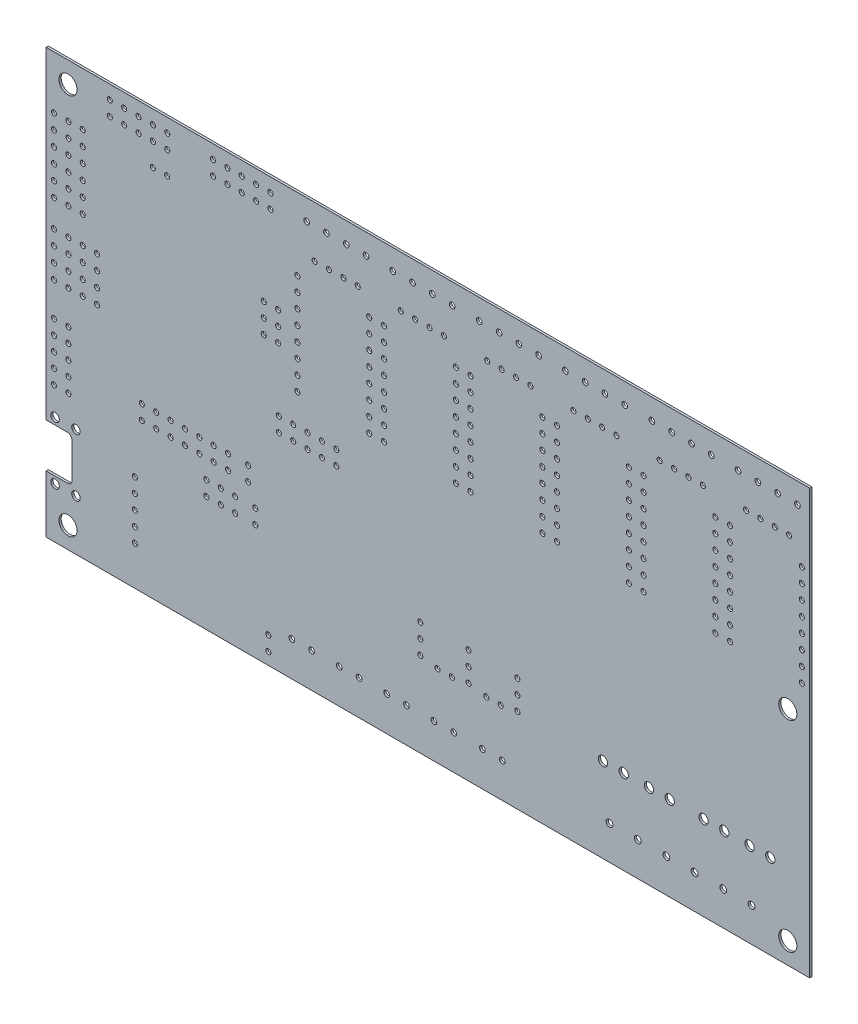
from build123d import *

# Parameters (mm, degrees)
SKETCH1_W             = 135
SKETCH1_H             = 75
BOARD_DEPTH           = 0.39116
SKETCH2_R             = 1.6
CUT_EXTRUDE1_DEPTH    = 0.39116
SKETCH3_R             = 1.6
CUT_EXTRUDE2_DEPTH    = 155.43494749
SKETCH4_R             = 1.6
CUT_EXTRUDE3_DEPTH    = 155.43494749
SKETCH5_R             = 1.6
CUT_EXTRUDE4_DEPTH    = 155.43494749
CUTOUT_CUTOUT_1_DEPTH = 0.39116
SKETCH7_R             = 0.5
SKETCH7_R_2           = 0.45
SKETCH7_R_3           = 0.6
SKETCH7_R_4           = 0.75
SKETCH7_R_5           = 0.825
CUT_EXTRUDE6_DEPTH    = 155.43494749


with BuildPart() as part:
    # Sketch1 → Board (new body)
    with BuildSketch(Plane.XY):
        with Locations((67.5, 37.5)):
            Rectangle(SKETCH1_W, SKETCH1_H)
    extrude(amount=BOARD_DEPTH)

    # Sketch2 → Cut-Extrude1 (cut)
    with BuildSketch(Plane.XY.offset(0.39116)):
        with Locations((131.125, 39.25)):
            Circle(SKETCH2_R)
    extrude(amount=-CUT_EXTRUDE1_DEPTH, mode=Mode.SUBTRACT)

    # Sketch3 → Cut-Extrude2 (cut, through all)
    with BuildSketch(Plane.XY.offset(0.39116)):
        with Locations((131.125, 3.75)):
            Circle(SKETCH3_R)
    extrude(amount=-CUT_EXTRUDE2_DEPTH, mode=Mode.SUBTRACT)

    # Sketch4 → Cut-Extrude3 (cut, through all)
    with BuildSketch(Plane.XY.offset(0.39116)):
        with Locations((3.875, 3.75)):
            Circle(SKETCH4_R)
    extrude(amount=-CUT_EXTRUDE3_DEPTH, mode=Mode.SUBTRACT)

    # Sketch5 → Cut-Extrude4 (cut, through all)
    with BuildSketch(Plane.XY.offset(0.39116)):
        with Locations((3.875, 71.25)):
            Circle(SKETCH5_R)
    extrude(amount=-CUT_EXTRUDE4_DEPTH, mode=Mode.SUBTRACT)

    # Sketch6 → Cutout - Cutout 1 (cut)
    with BuildSketch(Plane.XY.offset(0.39116)):
        with BuildLine():
            Line((3.77875, 10.1428), (-0.0178, 10.1428))
            Line((-0.0178, 10.1428), (-0.0178, 17.9428))
            Line((-0.0178, 17.9428), (3.77875, 17.9428))
            ThreePointArc((3.77875, 17.9428), (4.344435425, 17.708485425), (4.57875, 17.1428))
            Line((4.57875, 17.1428), (4.57875, 10.94281))
            ThreePointArc((4.57875, 10.94281), (4.344437496, 10.377119575), (3.77875, 10.1428))
        make_face()
    extrude(amount=-CUTOUT_CUTOUT_1_DEPTH, mode=Mode.SUBTRACT)

    # Sketch7 → Cut-Extrude6 (cut, through all)
    with BuildSketch(Plane.XY.offset(0.39116)):
        with Locations((87.08105, 71.37134)):
            Circle(SKETCH7_R)
        with Locations((83.58103, 71.37134)):
            Circle(SKETCH7_R)
        with Locations((80.08106, 71.37134)):
            Circle(SKETCH7_R)
        with Locations((76.58105, 71.37134)):
            Circle(SKETCH7_R)
        with Locations((71.78256, 71.37134)):
            Circle(SKETCH7_R)
        with Locations((68.28254, 71.37134)):
            Circle(SKETCH7_R)
        with Locations((64.78258, 71.37134)):
            Circle(SKETCH7_R)
        with Locations((61.28256, 71.37134)):
            Circle(SKETCH7_R)
        with Locations((56.56391, 71.37134)):
            Circle(SKETCH7_R)
        with Locations((53.06389, 71.37134)):
            Circle(SKETCH7_R)
        with Locations((49.56393, 71.37134)):
            Circle(SKETCH7_R)
        with Locations((46.06391, 71.37134)):
            Circle(SKETCH7_R)
        with Locations((132.83135, 71.37134)):
            Circle(SKETCH7_R)
        with Locations((129.33133, 71.37134)):
            Circle(SKETCH7_R)
        with Locations((125.83136, 71.37134)):
            Circle(SKETCH7_R)
        with Locations((122.33135, 71.37134)):
            Circle(SKETCH7_R)
        with Locations((117.59975, 71.37134)):
            Circle(SKETCH7_R)
        with Locations((114.09973, 71.37134)):
            Circle(SKETCH7_R)
        with Locations((110.59976, 71.37134)):
            Circle(SKETCH7_R)
        with Locations((107.09975, 71.37134)):
            Circle(SKETCH7_R)
        with Locations((102.30313, 71.37134)):
            Circle(SKETCH7_R)
        with Locations((98.80311, 71.37134)):
            Circle(SKETCH7_R)
        with Locations((95.30314, 71.37134)):
            Circle(SKETCH7_R)
        with Locations((91.80312, 71.37134)):
            Circle(SKETCH7_R)
        with Locations((1.3965, 63.0504)):
            Circle(SKETCH7_R_2)
        with Locations((3.9365, 63.0504)):
            Circle(SKETCH7_R_2)
        with Locations((6.4765, 63.0504)):
            Circle(SKETCH7_R_2)
        with Locations((1.3965, 65.6412)):
            Circle(SKETCH7_R_2)
        with Locations((3.9365, 65.6412)):
            Circle(SKETCH7_R_2)
        with Locations((6.4765, 65.6412)):
            Circle(SKETCH7_R_2)
        with Locations((1.3965, 57.8688)):
            Circle(SKETCH7_R_2)
        with Locations((3.9365, 57.8688)):
            Circle(SKETCH7_R_2)
        with Locations((6.4765, 57.8688)):
            Circle(SKETCH7_R_2)
        with Locations((1.3965, 60.4596)):
            Circle(SKETCH7_R_2)
        with Locations((3.9365, 60.4596)):
            Circle(SKETCH7_R_2)
        with Locations((6.4765, 60.4596)):
            Circle(SKETCH7_R_2)
        with Locations((1.3965, 52.6872)):
            Circle(SKETCH7_R_2)
        with Locations((3.9365, 52.6872)):
            Circle(SKETCH7_R_2)
        with Locations((6.4765, 52.6872)):
            Circle(SKETCH7_R_2)
        with Locations((1.3965, 55.278)):
            Circle(SKETCH7_R_2)
        with Locations((3.9365, 55.278)):
            Circle(SKETCH7_R_2)
        with Locations((6.4765, 55.278)):
            Circle(SKETCH7_R_2)
        with Locations((66.15636, 20.06533)):
            Circle(SKETCH7_R_2)
        with Locations((66.15636, 17.52533)):
            Circle(SKETCH7_R_2)
        with Locations((66.15636, 14.98533)):
            Circle(SKETCH7_R_2)
        with Locations((74.68827, 20.06533)):
            Circle(SKETCH7_R_2)
        with Locations((74.68827, 17.52533)):
            Circle(SKETCH7_R_2)
        with Locations((74.68827, 14.98533)):
            Circle(SKETCH7_R_2)
        with Locations((83.3234, 20.06533)):
            Circle(SKETCH7_R_2)
        with Locations((83.3234, 17.52533)):
            Circle(SKETCH7_R_2)
        with Locations((83.3234, 14.98533)):
            Circle(SKETCH7_R_2)
        with Locations((3.93634, 24.00453)):
            Circle(SKETCH7_R_2)
        with Locations((1.39634, 24.00453)):
            Circle(SKETCH7_R_2)
        with Locations((3.93634, 26.54453)):
            Circle(SKETCH7_R_2)
        with Locations((1.39634, 26.54453)):
            Circle(SKETCH7_R_2)
        with Locations((3.93634, 29.08453)):
            Circle(SKETCH7_R_2)
        with Locations((1.39634, 29.08453)):
            Circle(SKETCH7_R_2)
        with Locations((3.93634, 31.62453)):
            Circle(SKETCH7_R_2)
        with Locations((1.39634, 31.62453)):
            Circle(SKETCH7_R_2)
        with Locations((3.93634, 34.16453)):
            Circle(SKETCH7_R_2)
        with Locations((1.39634, 34.16453)):
            Circle(SKETCH7_R_2)
        with Locations((11.26717, 70.03266)):
            Circle(SKETCH7_R_2)
        with Locations((11.26717, 72.57266)):
            Circle(SKETCH7_R_2)
        with Locations((13.80717, 70.03266)):
            Circle(SKETCH7_R_2)
        with Locations((13.80717, 72.57266)):
            Circle(SKETCH7_R_2)
        with Locations((16.34717, 70.03266)):
            Circle(SKETCH7_R_2)
        with Locations((16.34717, 72.57266)):
            Circle(SKETCH7_R_2)
        with Locations((18.88717, 70.03266)):
            Circle(SKETCH7_R_2)
        with Locations((18.88717, 72.57266)):
            Circle(SKETCH7_R_2)
        with Locations((21.42717, 70.03266)):
            Circle(SKETCH7_R_2)
        with Locations((21.42717, 72.57266)):
            Circle(SKETCH7_R_2)
        with Locations((29.50859, 70.03266)):
            Circle(SKETCH7_R_2)
        with Locations((29.50859, 72.57266)):
            Circle(SKETCH7_R_2)
        with Locations((32.04859, 70.03266)):
            Circle(SKETCH7_R_2)
        with Locations((32.04859, 72.57266)):
            Circle(SKETCH7_R_2)
        with Locations((34.58859, 70.03266)):
            Circle(SKETCH7_R_2)
        with Locations((34.58859, 72.57266)):
            Circle(SKETCH7_R_2)
        with Locations((37.12859, 70.03266)):
            Circle(SKETCH7_R_2)
        with Locations((37.12859, 72.57266)):
            Circle(SKETCH7_R_2)
        with Locations((39.66859, 70.03266)):
            Circle(SKETCH7_R_2)
        with Locations((39.66859, 72.57266)):
            Circle(SKETCH7_R_2)
        with Locations((41.15206, 36.56666)):
            Circle(SKETCH7_R_2)
        with Locations((41.15206, 39.10666)):
            Circle(SKETCH7_R_2)
        with Locations((43.69206, 36.56666)):
            Circle(SKETCH7_R_2)
        with Locations((43.69206, 39.10666)):
            Circle(SKETCH7_R_2)
        with Locations((46.23206, 36.56666)):
            Circle(SKETCH7_R_2)
        with Locations((46.23206, 39.10666)):
            Circle(SKETCH7_R_2)
        with Locations((48.77206, 36.56666)):
            Circle(SKETCH7_R_2)
        with Locations((48.77206, 39.10666)):
            Circle(SKETCH7_R_2)
        with Locations((51.31206, 36.56666)):
            Circle(SKETCH7_R_2)
        with Locations((51.31206, 39.10666)):
            Circle(SKETCH7_R_2)
        with Locations((1.39654, 47.88812)):
            Circle(SKETCH7_R_2)
        with Locations((3.93654, 47.88812)):
            Circle(SKETCH7_R_2)
        with Locations((6.47654, 47.88812)):
            Circle(SKETCH7_R_2)
        with Locations((9.01654, 47.88812)):
            Circle(SKETCH7_R_2)
        with Locations((1.39654, 45.29713)):
            Circle(SKETCH7_R_2)
        with Locations((3.93654, 45.29713)):
            Circle(SKETCH7_R_2)
        with Locations((6.47654, 45.29713)):
            Circle(SKETCH7_R_2)
        with Locations((9.01654, 45.29713)):
            Circle(SKETCH7_R_2)
        with Locations((1.39654, 42.70612)):
            Circle(SKETCH7_R_2)
        with Locations((3.93654, 42.70612)):
            Circle(SKETCH7_R_2)
        with Locations((6.47654, 42.70612)):
            Circle(SKETCH7_R_2)
        with Locations((9.01654, 42.70612)):
            Circle(SKETCH7_R_2)
        with Locations((1.39654, 40.11512)):
            Circle(SKETCH7_R_2)
        with Locations((3.93654, 40.11512)):
            Circle(SKETCH7_R_2)
        with Locations((6.47654, 40.11512)):
            Circle(SKETCH7_R_2)
        with Locations((9.01654, 40.11512)):
            Circle(SKETCH7_R_2)
        with Locations((100.84701, 65.98605)):
            Circle(SKETCH7_R_2)
        with Locations((98.30701, 65.98605)):
            Circle(SKETCH7_R_2)
        with Locations((95.76701, 65.98605)):
            Circle(SKETCH7_R_2)
        with Locations((93.22701, 65.98605)):
            Circle(SKETCH7_R_2)
        with Locations((116.10006, 65.98605)):
            Circle(SKETCH7_R_2)
        with Locations((113.56006, 65.98605)):
            Circle(SKETCH7_R_2)
        with Locations((111.02006, 65.98605)):
            Circle(SKETCH7_R_2)
        with Locations((108.48006, 65.98605)):
            Circle(SKETCH7_R_2)
        with Locations((131.36105, 65.98605)):
            Circle(SKETCH7_R_2)
        with Locations((128.82105, 65.98605)):
            Circle(SKETCH7_R_2)
        with Locations((126.28105, 65.98605)):
            Circle(SKETCH7_R_2)
        with Locations((123.74105, 65.98605)):
            Circle(SKETCH7_R_2)
        with Locations((55.09869, 65.98605)):
            Circle(SKETCH7_R_2)
        with Locations((52.55869, 65.98605)):
            Circle(SKETCH7_R_2)
        with Locations((50.01869, 65.98605)):
            Circle(SKETCH7_R_2)
        with Locations((47.47869, 65.98605)):
            Circle(SKETCH7_R_2)
        with Locations((70.32054, 65.98605)):
            Circle(SKETCH7_R_2)
        with Locations((67.78054, 65.98605)):
            Circle(SKETCH7_R_2)
        with Locations((65.24054, 65.98605)):
            Circle(SKETCH7_R_2)
        with Locations((62.70054, 65.98605)):
            Circle(SKETCH7_R_2)
        with Locations((85.61429, 65.98605)):
            Circle(SKETCH7_R_2)
        with Locations((83.07429, 65.98605)):
            Circle(SKETCH7_R_2)
        with Locations((80.53429, 65.98605)):
            Circle(SKETCH7_R_2)
        with Locations((77.99429, 65.98605)):
            Circle(SKETCH7_R_2)
        with Locations((16.93009, 26.32905)):
            Circle(SKETCH7_R_2)
        with Locations((16.93009, 28.86905)):
            Circle(SKETCH7_R_2)
        with Locations((19.47009, 26.32905)):
            Circle(SKETCH7_R_2)
        with Locations((19.47009, 28.86905)):
            Circle(SKETCH7_R_2)
        with Locations((22.01009, 26.32905)):
            Circle(SKETCH7_R_2)
        with Locations((22.01009, 28.86905)):
            Circle(SKETCH7_R_2)
        with Locations((24.55009, 26.32905)):
            Circle(SKETCH7_R_2)
        with Locations((24.55009, 28.86905)):
            Circle(SKETCH7_R_2)
        with Locations((27.09009, 26.32905)):
            Circle(SKETCH7_R_2)
        with Locations((27.09009, 28.86905)):
            Circle(SKETCH7_R_2)
        with Locations((29.63009, 26.32905)):
            Circle(SKETCH7_R_2)
        with Locations((29.63009, 28.86905)):
            Circle(SKETCH7_R_2)
        with Locations((32.17009, 26.32905)):
            Circle(SKETCH7_R_2)
        with Locations((32.17009, 28.86905)):
            Circle(SKETCH7_R_2)
        with Locations((41.0197, 50.24407)):
            Circle(SKETCH7_R_2)
        with Locations((38.4797, 50.24407)):
            Circle(SKETCH7_R_2)
        with Locations((41.0197, 52.78407)):
            Circle(SKETCH7_R_2)
        with Locations((38.4797, 52.78407)):
            Circle(SKETCH7_R_2)
        with Locations((41.0197, 55.32407)):
            Circle(SKETCH7_R_2)
        with Locations((38.4797, 55.32407)):
            Circle(SKETCH7_R_2)
        with Locations((33.42183, 22.934)):
            Circle(SKETCH7_R_2)
        with Locations((33.42183, 20.394)):
            Circle(SKETCH7_R_2)
        with Locations((30.88183, 22.934)):
            Circle(SKETCH7_R_2)
        with Locations((30.88183, 20.394)):
            Circle(SKETCH7_R_2)
        with Locations((28.34183, 22.934)):
            Circle(SKETCH7_R_2)
        with Locations((28.34183, 20.394)):
            Circle(SKETCH7_R_2)
        with Locations((21.41071, 66.01544)):
            Circle(SKETCH7_R_2)
        with Locations((18.87071, 66.01544)):
            Circle(SKETCH7_R_2)
        with Locations((69.19941, 14.45314)):
            Circle(SKETCH7_R_2)
        with Locations((71.73941, 14.45314)):
            Circle(SKETCH7_R_2)
        with Locations((77.83601, 14.45314)):
            Circle(SKETCH7_R_2)
        with Locations((80.37601, 14.45314)):
            Circle(SKETCH7_R_2)
        with Locations((36.9854, 22.934)):
            Circle(SKETCH7_R_2)
        with Locations((36.9854, 20.394)):
            Circle(SKETCH7_R_2)
        with Locations((35.72598, 28.86893)):
            Circle(SKETCH7_R_2)
        with Locations((35.72598, 26.32893)):
            Circle(SKETCH7_R_2)
        with Locations((39.28942, 4.67586)):
            Circle(SKETCH7_R_2)
        with Locations((39.28942, 2.13586)):
            Circle(SKETCH7_R_2)
        with Locations((103.02669, 52.08593)):
            Circle(SKETCH7_R_2)
        with Locations((103.02669, 49.54593)):
            Circle(SKETCH7_R_2)
        with Locations((103.02669, 54.62593)):
            Circle(SKETCH7_R_2)
        with Locations((103.02669, 57.16593)):
            Circle(SKETCH7_R_2)
        with Locations((90.32669, 44.46593)):
            Circle(SKETCH7_R_2)
        with Locations((90.32669, 62.24593)):
            Circle(SKETCH7_R_2)
        with Locations((103.02669, 44.46593)):
            Circle(SKETCH7_R_2)
        with Locations((103.02669, 59.70593)):
            Circle(SKETCH7_R_2)
        with Locations((90.32669, 59.70593)):
            Circle(SKETCH7_R_2)
        with Locations((90.32669, 57.16593)):
            Circle(SKETCH7_R_2)
        with Locations((90.32669, 54.62593)):
            Circle(SKETCH7_R_2)
        with Locations((90.32669, 52.08593)):
            Circle(SKETCH7_R_2)
        with Locations((90.32669, 49.54593)):
            Circle(SKETCH7_R_2)
        with Locations((90.32669, 47.00593)):
            Circle(SKETCH7_R_2)
        with Locations((103.02669, 47.00593)):
            Circle(SKETCH7_R_2)
        with Locations((103.02669, 62.24593)):
            Circle(SKETCH7_R_2)
        with Locations((118.31794, 52.08593)):
            Circle(SKETCH7_R_2)
        with Locations((118.31794, 49.54593)):
            Circle(SKETCH7_R_2)
        with Locations((118.31794, 54.62593)):
            Circle(SKETCH7_R_2)
        with Locations((118.31794, 57.16593)):
            Circle(SKETCH7_R_2)
        with Locations((105.61794, 44.46593)):
            Circle(SKETCH7_R_2)
        with Locations((105.61794, 62.24593)):
            Circle(SKETCH7_R_2)
        with Locations((118.31794, 44.46593)):
            Circle(SKETCH7_R_2)
        with Locations((118.31794, 59.70593)):
            Circle(SKETCH7_R_2)
        with Locations((105.61794, 59.70593)):
            Circle(SKETCH7_R_2)
        with Locations((105.61794, 57.16593)):
            Circle(SKETCH7_R_2)
        with Locations((105.61794, 54.62593)):
            Circle(SKETCH7_R_2)
        with Locations((105.61794, 52.08593)):
            Circle(SKETCH7_R_2)
        with Locations((105.61794, 49.54593)):
            Circle(SKETCH7_R_2)
        with Locations((105.61794, 47.00593)):
            Circle(SKETCH7_R_2)
        with Locations((118.31794, 47.00593)):
            Circle(SKETCH7_R_2)
        with Locations((118.31794, 62.24593)):
            Circle(SKETCH7_R_2)
        with Locations((133.61413, 52.08594)):
            Circle(SKETCH7_R_2)
        with Locations((133.61413, 49.54594)):
            Circle(SKETCH7_R_2)
        with Locations((133.61413, 54.62594)):
            Circle(SKETCH7_R_2)
        with Locations((133.61413, 57.16594)):
            Circle(SKETCH7_R_2)
        with Locations((120.91413, 44.46594)):
            Circle(SKETCH7_R_2)
        with Locations((120.91413, 62.24594)):
            Circle(SKETCH7_R_2)
        with Locations((133.61413, 44.46594)):
            Circle(SKETCH7_R_2)
        with Locations((133.61413, 59.70594)):
            Circle(SKETCH7_R_2)
        with Locations((120.91413, 59.70594)):
            Circle(SKETCH7_R_2)
        with Locations((120.91413, 57.16594)):
            Circle(SKETCH7_R_2)
        with Locations((120.91413, 54.62594)):
            Circle(SKETCH7_R_2)
        with Locations((120.91413, 52.08594)):
            Circle(SKETCH7_R_2)
        with Locations((120.91413, 49.54594)):
            Circle(SKETCH7_R_2)
        with Locations((120.91413, 47.00594)):
            Circle(SKETCH7_R_2)
        with Locations((133.61413, 47.00594)):
            Circle(SKETCH7_R_2)
        with Locations((133.61413, 62.24594)):
            Circle(SKETCH7_R_2)
        with Locations((57.13111, 52.08592)):
            Circle(SKETCH7_R_2)
        with Locations((57.13111, 49.54592)):
            Circle(SKETCH7_R_2)
        with Locations((57.13111, 54.62592)):
            Circle(SKETCH7_R_2)
        with Locations((57.13111, 57.16592)):
            Circle(SKETCH7_R_2)
        with Locations((44.43111, 44.46592)):
            Circle(SKETCH7_R_2)
        with Locations((44.43111, 62.24592)):
            Circle(SKETCH7_R_2)
        with Locations((57.13111, 44.46592)):
            Circle(SKETCH7_R_2)
        with Locations((57.13111, 59.70592)):
            Circle(SKETCH7_R_2)
        with Locations((44.43111, 59.70592)):
            Circle(SKETCH7_R_2)
        with Locations((44.43111, 57.16592)):
            Circle(SKETCH7_R_2)
        with Locations((44.43111, 54.62592)):
            Circle(SKETCH7_R_2)
        with Locations((44.43111, 52.08592)):
            Circle(SKETCH7_R_2)
        with Locations((44.43111, 49.54592)):
            Circle(SKETCH7_R_2)
        with Locations((44.43111, 47.00592)):
            Circle(SKETCH7_R_2)
        with Locations((57.13111, 47.00592)):
            Circle(SKETCH7_R_2)
        with Locations((57.13111, 62.24592)):
            Circle(SKETCH7_R_2)
        with Locations((72.44578, 52.08593)):
            Circle(SKETCH7_R_2)
        with Locations((72.44578, 49.54593)):
            Circle(SKETCH7_R_2)
        with Locations((72.44578, 54.62593)):
            Circle(SKETCH7_R_2)
        with Locations((72.44578, 57.16593)):
            Circle(SKETCH7_R_2)
        with Locations((59.74578, 44.46593)):
            Circle(SKETCH7_R_2)
        with Locations((59.74578, 62.24593)):
            Circle(SKETCH7_R_2)
        with Locations((72.44578, 44.46593)):
            Circle(SKETCH7_R_2)
        with Locations((72.44578, 59.70593)):
            Circle(SKETCH7_R_2)
        with Locations((59.74578, 59.70593)):
            Circle(SKETCH7_R_2)
        with Locations((59.74578, 57.16593)):
            Circle(SKETCH7_R_2)
        with Locations((59.74578, 54.62593)):
            Circle(SKETCH7_R_2)
        with Locations((59.74578, 52.08593)):
            Circle(SKETCH7_R_2)
        with Locations((59.74578, 49.54593)):
            Circle(SKETCH7_R_2)
        with Locations((59.74578, 47.00593)):
            Circle(SKETCH7_R_2)
        with Locations((72.44578, 47.00593)):
            Circle(SKETCH7_R_2)
        with Locations((72.44578, 62.24593)):
            Circle(SKETCH7_R_2)
        with Locations((87.73445, 52.08593)):
            Circle(SKETCH7_R_2)
        with Locations((87.73445, 49.54593)):
            Circle(SKETCH7_R_2)
        with Locations((87.73445, 54.62593)):
            Circle(SKETCH7_R_2)
        with Locations((87.73445, 57.16593)):
            Circle(SKETCH7_R_2)
        with Locations((75.03445, 44.46593)):
            Circle(SKETCH7_R_2)
        with Locations((75.03445, 62.24593)):
            Circle(SKETCH7_R_2)
        with Locations((87.73445, 44.46593)):
            Circle(SKETCH7_R_2)
        with Locations((87.73445, 59.70593)):
            Circle(SKETCH7_R_2)
        with Locations((75.03445, 59.70593)):
            Circle(SKETCH7_R_2)
        with Locations((75.03445, 57.16593)):
            Circle(SKETCH7_R_2)
        with Locations((75.03445, 54.62593)):
            Circle(SKETCH7_R_2)
        with Locations((75.03445, 52.08593)):
            Circle(SKETCH7_R_2)
        with Locations((75.03445, 49.54593)):
            Circle(SKETCH7_R_2)
        with Locations((75.03445, 47.00593)):
            Circle(SKETCH7_R_2)
        with Locations((87.73445, 47.00593)):
            Circle(SKETCH7_R_2)
        with Locations((87.73445, 62.24593)):
            Circle(SKETCH7_R_2)
        with Locations((46.94455, 6.12189)):
            Circle(SKETCH7_R)
        with Locations((43.44453, 6.12189)):
            Circle(SKETCH7_R)
        with Locations((55.324, 6.12189)):
            Circle(SKETCH7_R)
        with Locations((51.82398, 6.12189)):
            Circle(SKETCH7_R)
        with Locations((63.70625, 6.12189)):
            Circle(SKETCH7_R)
        with Locations((60.20623, 6.12189)):
            Circle(SKETCH7_R)
        with Locations((72.06951, 6.12189)):
            Circle(SKETCH7_R)
        with Locations((68.56949, 6.12189)):
            Circle(SKETCH7_R)
        with Locations((80.6341, 6.12189)):
            Circle(SKETCH7_R)
        with Locations((77.13408, 6.12189)):
            Circle(SKETCH7_R)
        with Locations((124.71359, 5.9848)):
            Circle(SKETCH7_R_3)
        with Locations((119.7136, 5.9848)):
            Circle(SKETCH7_R_3)
        with Locations((114.65742, 5.9848)):
            Circle(SKETCH7_R_3)
        with Locations((109.65743, 5.9848)):
            Circle(SKETCH7_R_3)
        with Locations((104.5996, 5.9848)):
            Circle(SKETCH7_R_3)
        with Locations((99.59961, 5.9848)):
            Circle(SKETCH7_R_3)
        with Locations((5.2822, 19.1428)):
            Circle(SKETCH7_R_4)
        with Locations((5.2822, 8.9428)):
            Circle(SKETCH7_R_4)
        with Locations((1.5822, 8.9428)):
            Circle(SKETCH7_R_4)
        with Locations((1.5822, 19.1428)):
            Circle(SKETCH7_R_4)
        with Locations((15.68797, 6.90736)):
            Circle(SKETCH7_R_2)
        with Locations((15.68797, 9.44736)):
            Circle(SKETCH7_R_2)
        with Locations((15.68797, 11.98736)):
            Circle(SKETCH7_R_2)
        with Locations((15.68797, 14.52736)):
            Circle(SKETCH7_R_2)
        with Locations((15.68797, 17.06736)):
            Circle(SKETCH7_R_2)
        with Locations((128.03199, 14.94746)):
            Circle(SKETCH7_R_5)
        with Locations((124.37199, 14.94746)):
            Circle(SKETCH7_R_5)
        with Locations((119.902, 14.94746)):
            Circle(SKETCH7_R_5)
        with Locations((116.242, 14.94746)):
            Circle(SKETCH7_R_5)
        with Locations((102.11738, 14.94745)):
            Circle(SKETCH7_R_5)
        with Locations((98.45738, 14.94745)):
            Circle(SKETCH7_R_5)
        with Locations((110.24738, 14.94745)):
            Circle(SKETCH7_R_5)
        with Locations((106.58738, 14.94745)):
            Circle(SKETCH7_R_5)
    extrude(amount=-CUT_EXTRUDE6_DEPTH, mode=Mode.SUBTRACT)


solid = part.part
